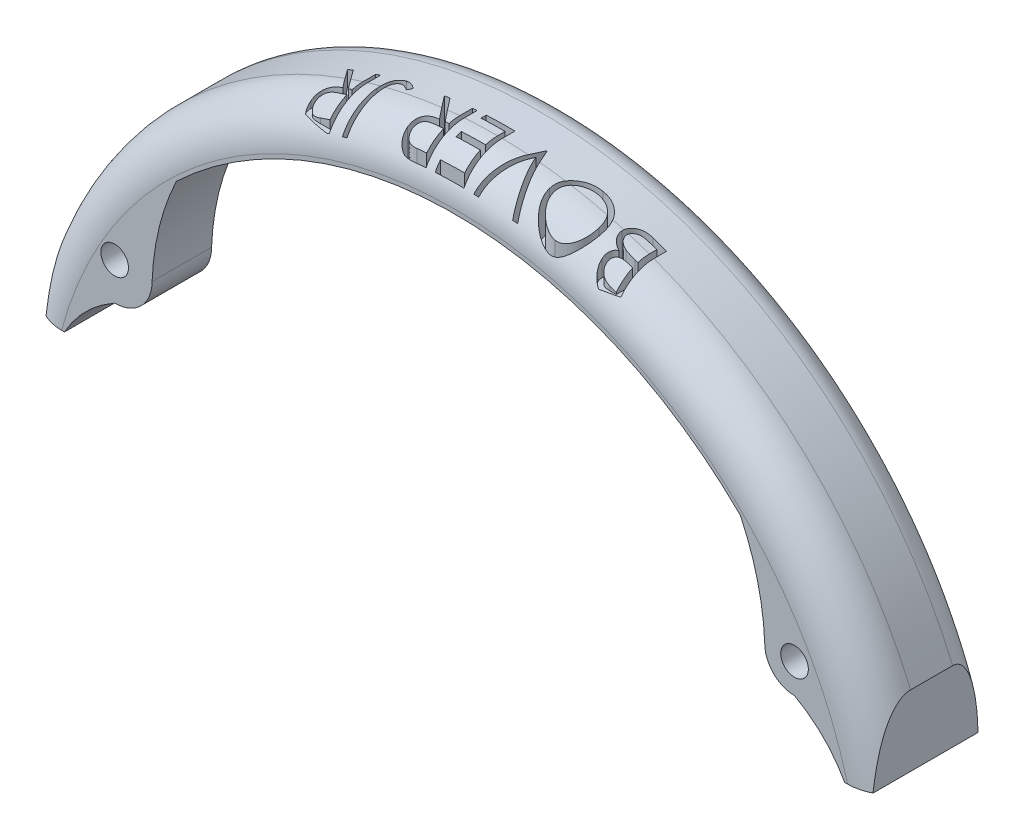
from build123d import *

# Parameters (mm, degrees)
CROQUIS1_R              = 1.625
SALIENTE_EXTRUIR1_DEPTH = 7
CORTAR_EXTRUIR4_START   = -7
CORTAR_EXTRUIR4_DEPTH   = 7
REDONDEO28_R            = 5
SALIENTE_EXTRUIR7_START = 5.95
SALIENTE_EXTRUIR7_DEPTH = 5.95
REDONDEO29_R            = 3
SALIENTE_EXTRUIR9_START = -12.95
CROQUIS18_W             = 3.387599535
CROQUIS18_H             = 3.438504458
SALIENTE_EXTRUIR9_DEPTH = 12.95
CORTAR_EXTRUIR12_DEPTH  = 8.75
CORTAR_EXTRUIR13_START  = -12.95
CROQUIS20_W             = 3.387599535
CROQUIS20_H             = 3.438504458
CORTAR_EXTRUIR13_DEPTH  = 12.95


with BuildPart() as part:
    # Croquis1 → Saliente-Extruir1 (new body)
    with BuildSketch(Plane.XY):
        with BuildLine():
            Line((201.408456983, -67.29), (195.908456983, -67.29))
            ThreePointArc((195.908456983, -67.29), (193.371958741, -63.925960745), (190, -61.4))
            ThreePointArc((190, -61.4), (187.525126266, -60.374873734), (186.5, -57.9))
            ThreePointArc((186.5, -57.9), (185.662126041, -51.918358313), (183.64304007, -46.225787551))
            ThreePointArc((183.64304007, -46.225787551), (150.62771573, -32.309143921), (117.25695993, -45.350511509))
            ThreePointArc((117.25695993, -45.350511509), (115.240326599, -51.031015035), (114.4, -57))
            ThreePointArc((114.4, -57), (113.111269837, -60.111269837), (110, -61.4))
            ThreePointArc((110, -61.4), (106.628041259, -63.925960745), (104.091543017, -67.29))
            Line((104.091543017, -67.29), (98.591543017, -67.29))
            ThreePointArc((98.591543017, -67.29), (150, -26.805006), (201.408456983, -67.29))
        make_face()
        with Locations((110, -57)):
            Circle(CROQUIS1_R, mode=Mode.SUBTRACT)
        with Locations((190, -57.9)):
            Circle(CROQUIS1_R, mode=Mode.SUBTRACT)
    extrude(amount=SALIENTE_EXTRUIR1_DEPTH)

    # Croquis7 → Cortar-Extruir4 (cut)
    with BuildSketch(Plane.XY.offset(7).offset(CORTAR_EXTRUIR4_START)):
        with BuildLine():
            Line((98.591543017, -67.29), (101.341543017, -67.29))
            Line((101.341543017, -67.29), (101.341543017, -58.977880832))
            ThreePointArc((101.341543017, -58.977880832), (99.794226936, -63.076930981), (98.591543017, -67.29))
        make_face()
        with BuildLine():
            Line((198.658456983, -58.977880832), (198.658456983, -67.29))
            Line((198.658456983, -67.29), (201.408456983, -67.29))
            ThreePointArc((201.408456983, -67.29), (200.205773064, -63.076930981), (198.658456983, -58.977880832))
        make_face()
    extrude(amount=CORTAR_EXTRUIR4_DEPTH, mode=Mode.SUBTRACT)

    # Redondeo28
    redondeo28_edges = [part.edges().sort_by_distance(p)[0] for p in [
        (150, -26.805006, 7),
    ]]
    fillet(redondeo28_edges, radius=REDONDEO28_R)

    # Croquis15 → Saliente-Extruir7 (add)
    with BuildSketch(Plane(origin=(0, 0, 0), x_dir=(-1, 0, 0), z_dir=(0, 0, -1)).offset(SALIENTE_EXTRUIR7_START)):
        with BuildLine():
            Line((-198.658456983, -67.29), (-198.408456983, -67.29))
            ThreePointArc((-198.408456983, -67.29), (-150, -29.805006), (-101.591543017, -67.29))
            Line((-101.591543017, -67.29), (-101.341543017, -67.29))
            Line((-101.341543017, -67.29), (-101.341543017, -58.977880832))
            ThreePointArc((-101.341543017, -58.977880832), (-150, -26.805006), (-198.658456983, -58.977880832))
            Line((-198.658456983, -58.977880832), (-198.658456983, -67.29))
        make_face()
    extrude(amount=-SALIENTE_EXTRUIR7_DEPTH)

    # Redondeo29
    redondeo29_edges = [part.edges().sort_by_distance(p)[0] for p in [
        (150, -26.805006, -5.95),
    ]]
    fillet(redondeo29_edges, radius=REDONDEO29_R - 0.0001)  # a hair under: the kernel refuses the full size


with BuildPart() as body_2:
    # Croquis18 → Saliente-Extruir9 (new body)
    with BuildSketch(Plane.XY.offset(7).offset(SALIENTE_EXTRUIR9_START)):
        with Locations((148.306200233, -25.085753771)):
            Rectangle(CROQUIS18_W, CROQUIS18_H)
    extrude(amount=SALIENTE_EXTRUIR9_DEPTH)


with BuildPart() as cortar_extruir12_tool:
    # Croquis19 → Cortar-Extruir12 (new body)
    # profile 1 of 7: a face of its own
    with BuildSketch(Plane(origin=(0, -23.366501542, 0), x_dir=(1, 0, 0), z_dir=(0, 1, 0))):
        with BuildLine():
            Line((168.451541471, -6.5), (167.280868394, -6.5))
            add(Edge.make_bspline(
                [(167.280868394, -6.5), (167.223561527, -6.499703457), (167.112486558, -6.499128682), (166.950979797, -6.490007425), (166.799653574, -6.477881577), (166.658775302, -6.45754112), (166.527428306, -6.436450748), (166.406946034, -6.405495132), (166.296319298, -6.371303525), (166.163479231, -6.318695099), (166.012753973, -6.236993549), (165.850752524, -6.115822388), (165.709930979, -5.97054795), (165.590190924, -5.804996269), (165.494096983, -5.622870659), (165.425456752, -5.428089612), (165.381359654, -5.223930087), (165.376881554, -5.083959855), (165.374618394, -5.013221154)],
                knots=[0, 0, 0, 0, 1.00128172, 1.940733171, 2.826250472, 3.653024905, 4.427672124, 5.149348099, 5.824709082, 6.450061444, 7.643590664, 8.808605388, 9.972104426, 11.165284501, 12.367876273, 13.557044126, 14.765369432, 16, 16, 16, 16], degree=3))
            add(Edge.make_bspline(
                [(165.374618394, -5.013221154), (165.376466975, -4.946951168), (165.38009961, -4.816724396), (165.415587522, -4.626891205), (165.469155665, -4.445617524), (165.546457747, -4.274650282), (165.645024399, -4.115491762), (165.764945542, -3.970856804), (165.907139149, -3.843585065), (166.013898896, -3.772756532), (166.068128009, -3.736778846)],
                knots=[0, 0, 0, 0, 1.044356178, 2.052258378, 3.035953355, 4.020338374, 5.002448483, 5.980768927, 6.974322109, 8, 8, 8, 8], degree=3))
            add(Edge.make_bspline(
                [(166.068128009, -3.736778846), (165.999962439, -3.71062201), (165.869544817, -3.660577502), (165.689841078, -3.571756712), (165.534961878, -3.475891001), (165.402911249, -3.372277699), (165.292262152, -3.25753354), (165.193691494, -3.134680388), (165.110037606, -2.999439684), (165.038662176, -2.85474203), (164.982121493, -2.701353691), (164.942874398, -2.540422195), (164.917983765, -2.373770312), (164.914728861, -2.260505003), (164.913079932, -2.203125)],
                knots=[0, 0, 0, 0, 1.272200328, 2.434034374, 3.488177493, 4.442517805, 5.351202203, 6.260825393, 7.183200622, 8.11705787, 9.069326169, 10.026320267, 11.000137371, 12, 12, 12, 12], degree=3))
            add(Edge.make_bspline(
                [(164.913079932, -2.203125), (164.914754686, -2.144553317), (164.918049811, -2.029311889), (164.942356039, -1.860015981), (164.983522945, -1.698235472), (165.040185296, -1.542893485), (165.114047523, -1.39489981), (165.203280769, -1.253091381), (165.310379484, -1.119569822), (165.430983171, -0.992397568), (165.565542188, -0.876104037), (165.713815697, -0.7761652), (165.872003602, -0.689843918), (166.042272098, -0.620446449), (166.223413014, -0.566120924), (166.415468783, -0.528560346), (166.618330351, -0.503150379), (166.757549088, -0.501067945), (166.828945317, -0.5)],
                knots=[0, 0, 0, 0, 0.978522333, 1.925270105, 2.85076145, 3.763600118, 4.682725947, 5.609499657, 6.557784645, 7.537954401, 8.534920712, 9.522742111, 10.520247711, 11.5409147, 12.58930695, 13.675078472, 14.807699069, 16, 16, 16, 16], degree=3))
            Line((166.828945317, -0.5), (168.451541471, -0.5))
            Line((168.451541471, -0.5), (168.451541471, -6.5))
        make_face()
        with BuildLine():
            Line((167.913079932, -5.884615385), (167.913079932, -3.961538462))
            Line((167.913079932, -3.961538462), (167.551301086, -3.961538462))
            add(Edge.make_bspline(
                [(167.551301086, -3.961538462), (167.498416961, -3.962218339), (167.396234053, -3.963532), (167.247863841, -3.967413621), (167.110485575, -3.977806367), (166.983625904, -3.98879843), (166.868134998, -4.005723885), (166.763626546, -4.026436107), (166.669160697, -4.048148992), (166.560273583, -4.085181811), (166.436776924, -4.139339532), (166.306047749, -4.225446041), (166.188385615, -4.325138763), (166.091321145, -4.44338991), (166.010511452, -4.571090454), (165.956105423, -4.709192663), (165.918171516, -4.852937497), (165.914794513, -4.952071369), (165.913079932, -5.002403846)],
                knots=[0, 0, 0, 0, 1.156584208, 2.234756387, 3.244705828, 4.168772894, 5.018724976, 5.795346628, 6.498686023, 7.135894168, 8.308330183, 9.43588092, 10.547699294, 11.667188675, 12.76860303, 13.837480448, 14.902040606, 16, 16, 16, 16], degree=3))
            add(Edge.make_bspline(
                [(165.913079932, -5.002403846), (165.913916161, -5.035725045), (165.915556514, -5.101088215), (165.931020773, -5.1963186), (165.952361266, -5.28694029), (165.987557055, -5.370510288), (166.029254968, -5.449963077), (166.082701732, -5.522788895), (166.144330768, -5.590960602), (166.216182501, -5.652650918), (166.297963214, -5.708446249), (166.392263527, -5.754893197), (166.496519645, -5.796170034), (166.612905634, -5.827458844), (166.739103191, -5.854622511), (166.877037641, -5.871751769), (167.025877699, -5.882755875), (167.1290033, -5.883981723), (167.182310702, -5.884615385)],
                knots=[0, 0, 0, 0, 0.911412742, 1.787835618, 2.63643285, 3.453173233, 4.262886967, 5.08783453, 5.918594724, 6.773969545, 7.67442701, 8.62112486, 9.645634318, 10.739428598, 11.916091468, 13.177237585, 14.540865421, 16, 16, 16, 16], degree=3))
            Line((167.182310702, -5.884615385), (167.913079932, -5.884615385))
        make_face(mode=Mode.SUBTRACT)
        with BuildLine():
            Line((167.913079932, -3.346153846), (167.913079932, -1.115384615))
            Line((167.913079932, -1.115384615), (167.146253009, -1.115384615))
            add(Edge.make_bspline(
                [(167.146253009, -1.115384615), (167.091368909, -1.116105725), (166.985587042, -1.11749557), (166.832740006, -1.12079348), (166.691826737, -1.133028713), (166.561673985, -1.144759099), (166.442883954, -1.163923122), (166.334301207, -1.182480509), (166.238405826, -1.20978862), (166.126202692, -1.247365064), (166.000704614, -1.307417203), (165.863654792, -1.395729017), (165.742942406, -1.503299315), (165.640526406, -1.627160406), (165.555371992, -1.760445305), (165.496461954, -1.903416341), (165.458291604, -2.051298048), (165.453796045, -2.152414135), (165.451541471, -2.203125)],
                knots=[0, 0, 0, 0, 1.16016216, 2.236059617, 3.229676189, 4.14889023, 4.996733752, 5.772278665, 6.474820656, 7.101410824, 8.271817372, 9.403828207, 10.537358096, 11.673541442, 12.791884111, 13.865947414, 14.929748409, 16, 16, 16, 16], degree=3))
            add(Edge.make_bspline(
                [(165.451541471, -2.203125), (165.452001698, -2.234832625), (165.45291473, -2.297736427), (165.467266682, -2.390094221), (165.487183519, -2.48000191), (165.516535344, -2.566238249), (165.552043071, -2.650288214), (165.598886809, -2.729416974), (165.651726198, -2.806992913), (165.733566422, -2.906221129), (165.85422699, -3.019168728), (166.025750247, -3.128369659), (166.219687713, -3.217863225), (166.360679771, -3.255696627), (166.433512625, -3.275240385)],
                knots=[0, 0, 0, 0, 0.723354195, 1.435040621, 2.129761981, 2.824182007, 3.512608497, 4.209435533, 4.920062464, 5.654614313, 7.143585817, 8.671381114, 10.280521501, 12, 12, 12, 12], degree=3))
            add(Edge.make_bspline(
                [(166.433512625, -3.275240385), (166.462705333, -3.281163784), (166.526001147, -3.294006935), (166.629214666, -3.307555342), (166.7474427, -3.319708704), (166.880179921, -3.32846252), (167.027954243, -3.337859589), (167.190718192, -3.341384063), (167.368586834, -3.345685869), (167.49200248, -3.345993863), (167.556108778, -3.346153846)],
                knots=[0, 0, 0, 0, 0.634452549, 1.375623993, 2.216454381, 3.166361212, 4.209414599, 5.370755378, 6.634280627, 8, 8, 8, 8], degree=3))
            Line((167.556108778, -3.346153846), (167.913079932, -3.346153846))
        make_face(mode=Mode.SUBTRACT)
    # profile 2 of 7: a face of its own
    with BuildSketch(Plane(origin=(0, -23.366501542, 0), x_dir=(1, 0, 0), z_dir=(0, 1, 0))):
        with BuildLine():
            add(Edge.make_bspline(
                [(160.874618394, -6.653846154), (160.763506693, -6.651079535), (160.545274144, -6.645645668), (160.224836933, -6.602677828), (159.918005397, -6.53195532), (159.624596275, -6.432086813), (159.345750703, -6.302595472), (159.080587091, -6.145390078), (158.83001688, -5.958925611), (158.594688152, -5.747628415), (158.380797093, -5.51536865), (158.194677211, -5.26602143), (158.036271834, -5.004605418), (157.906848977, -4.729418181), (157.805152972, -4.441688345), (157.735017287, -4.139701845), (157.690205956, -3.825464048), (157.684967904, -3.611131971), (157.682310702, -3.502403846)],
                knots=[0, 0, 0, 0, 1.065027606, 2.091802087, 3.093458616, 4.079833113, 5.057734272, 6.036020118, 7.030157768, 8.047461502, 9.064242947, 10.052216774, 11.02588392, 11.989864716, 12.962978571, 13.945936472, 14.957997893, 16, 16, 16, 16], degree=3))
            add(Edge.make_bspline(
                [(157.682310702, -3.502403846), (157.684968793, -3.394477262), (157.690208201, -3.18174146), (157.735053697, -2.869488869), (157.805465741, -2.569357939), (157.905590903, -2.282046735), (158.035109092, -2.007414187), (158.193763722, -1.74581527), (158.379465448, -1.495740983), (158.592479545, -1.262350593), (158.825092679, -1.048439804), (159.072899365, -0.859339451), (159.335600576, -0.701808014), (159.609096187, -0.570450398), (159.896108089, -0.470964552), (160.194612061, -0.39846741), (160.506300643, -0.354107689), (160.718623167, -0.34883422), (160.826541471, -0.346153846)],
                knots=[0, 0, 0, 0, 1.043683505, 2.0572211, 3.045299494, 4.022276905, 4.994977706, 5.977452478, 6.97747046, 8.003698437, 9.029677512, 10.031249186, 11.013723958, 11.988083691, 12.9614021, 13.946617861, 14.956316495, 16, 16, 16, 16], degree=3))
            add(Edge.make_bspline(
                [(160.826541471, -0.346153846), (160.935269087, -0.348809581), (161.149600162, -0.354044743), (161.464232032, -0.398932262), (161.766433629, -0.469098611), (162.055274479, -0.569469066), (162.330849368, -0.698697758), (162.593131644, -0.857500628), (162.84243648, -1.044628001), (163.076226911, -1.257474817), (163.28987976, -1.489641901), (163.477799778, -1.737123213), (163.635687116, -1.997565062), (163.764970361, -2.269893858), (163.867228485, -2.553405678), (163.937014635, -2.849883918), (163.982160229, -3.157667248), (163.987363064, -3.367226321), (163.990003009, -3.473557692)],
                knots=[0, 0, 0, 0, 1.053167129, 2.076072758, 3.073341244, 4.055601477, 5.033424535, 6.017524495, 7.021518915, 8.049444456, 9.077120685, 10.074910483, 11.055688766, 12.022980584, 12.991883888, 13.970269434, 14.970104079, 16, 16, 16, 16], degree=3))
            add(Edge.make_bspline(
                [(163.990003009, -3.473557692), (163.989087332, -3.544928308), (163.987267528, -3.686769168), (163.965326547, -3.897392826), (163.933552832, -4.104651942), (163.887777923, -4.307849809), (163.828732174, -4.507019611), (163.755968305, -4.701754033), (163.672580882, -4.893657115), (163.573296638, -5.079076602), (163.464974555, -5.258303522), (163.346860208, -5.429096791), (163.218130048, -5.588405581), (163.080622955, -5.738789728), (162.932435522, -5.877682518), (162.775797966, -6.008112132), (162.609890688, -6.128728412), (162.434451302, -6.236998083), (162.253952702, -6.336445091), (162.06708536, -6.41947516), (161.877791991, -6.492862605), (161.684405224, -6.551183862), (161.487372394, -6.597596265), (161.286447189, -6.629132321), (161.08183656, -6.651122054), (160.9439883, -6.652934214), (160.874618394, -6.653846154)],
                knots=[0, 0, 0, 0, 1.037115869, 2.061148057, 3.07517727, 4.084041727, 5.086514338, 6.092668487, 7.104487461, 8.125783165, 9.147610153, 10.147694368, 11.141876323, 12.122903372, 13.107606018, 14.091946891, 15.084523921, 16.086505767, 17.087268121, 18.077809654, 19.05670789, 20.036870126, 21.011670792, 21.99694167, 22.991993299, 24, 24, 24, 24], degree=3))
        make_face()
        with BuildLine():
            add(Edge.make_bspline(
                [(160.848176086, -6.038461538), (160.905116317, -6.037770194), (161.018452425, -6.036394114), (161.186927506, -6.01815504), (161.353247196, -5.992371352), (161.517046095, -5.954828548), (161.678470688, -5.906724348), (161.837700151, -5.847322547), (161.994876676, -5.777974967), (162.148562966, -5.697478012), (162.29630459, -5.607249283), (162.438989271, -5.512118243), (162.571167706, -5.406692996), (162.695392966, -5.294883091), (162.811363666, -5.175149062), (162.919095299, -5.048372939), (163.018481727, -4.913980777), (163.108331649, -4.772532525), (163.188290816, -4.624816075), (163.259881678, -4.473655625), (163.319227753, -4.317274592), (163.366238692, -4.156648876), (163.406140205, -3.992486311), (163.431169388, -3.82389248), (163.449583212, -3.651448587), (163.450883692, -3.534907602), (163.451541471, -3.475961538)],
                knots=[0, 0, 0, 0, 1.008431664, 2.007222653, 2.999229743, 3.989431819, 4.982149843, 5.98167215, 6.998687425, 8.024288174, 9.053028776, 10.065052016, 11.06063401, 12.045759335, 13.024701188, 14.011819507, 14.991481775, 15.984022113, 16.97831254, 17.965966747, 18.945551853, 19.938269878, 20.93007375, 21.936103907, 22.956087853, 24, 24, 24, 24], degree=3))
            add(Edge.make_bspline(
                [(163.451541471, -3.475961538), (163.449350993, -3.389285416), (163.445041645, -3.21876667), (163.407471439, -2.968850306), (163.349139982, -2.728436265), (163.264570387, -2.498957506), (163.156685182, -2.279390722), (163.025087134, -2.070590388), (162.868571083, -1.872618097), (162.690887164, -1.686947554), (162.496594481, -1.51754616), (162.290383131, -1.368641445), (162.07388458, -1.243319084), (161.84834667, -1.138552406), (161.611843798, -1.05962555), (161.365892328, -1.003350738), (161.110486824, -0.966877433), (160.936442776, -0.963335008), (160.848176086, -0.961538462)],
                knots=[0, 0, 0, 0, 1.032022337, 2.030307203, 3.003823408, 3.974715386, 4.937372378, 5.913284036, 6.909147208, 7.938749767, 8.970518239, 9.975863271, 10.963918693, 11.946286286, 12.933361397, 13.927862637, 14.949112547, 16, 16, 16, 16], degree=3))
            add(Edge.make_bspline(
                [(160.848176086, -0.961538462), (160.788845277, -0.962352952), (160.671174462, -0.963968331), (160.496157013, -0.980261449), (160.324276288, -1.006336925), (160.155850418, -1.044066364), (159.990656679, -1.090659433), (159.829201134, -1.148462322), (159.671508868, -1.217720692), (159.516912011, -1.295030698), (159.36875912, -1.382221885), (159.228732636, -1.47802363), (159.095911722, -1.579870768), (158.971913205, -1.690870952), (158.856426661, -1.809594966), (158.750620437, -1.936907461), (158.651280348, -2.070292859), (158.56206062, -2.211705158), (158.481004569, -2.358252778), (158.41151679, -2.509853275), (158.352136611, -2.665546465), (158.304278718, -2.825485994), (158.266755505, -2.989301588), (158.240905647, -3.157230537), (158.222822222, -3.328932047), (158.221459285, -3.445064402), (158.22077224, -3.503605769)],
                knots=[0, 0, 0, 0, 1.047362266, 2.077233941, 3.100744636, 4.115120168, 5.122788643, 6.129711893, 7.140355774, 8.162227187, 9.180148637, 10.17298275, 11.156396779, 12.133377858, 13.108923632, 14.078087502, 15.054351192, 16.043448276, 17.028082865, 18.009331763, 18.985518559, 19.968016174, 20.954783108, 21.950335389, 22.966780876, 24, 24, 24, 24], degree=3))
            add(Edge.make_bspline(
                [(158.22077224, -3.503605769), (158.221459862, -3.561746634), (158.222823888, -3.677079748), (158.240896701, -3.847584008), (158.266783942, -4.0143038), (158.304091442, -4.176584604), (158.352177418, -4.334467792), (158.411469991, -4.487805065), (158.481387623, -4.637167721), (158.561630385, -4.78218638), (158.651828596, -4.921343578), (158.75039143, -5.054374416), (158.859012987, -5.178791806), (158.974618239, -5.297625188), (159.099986559, -5.408497746), (159.235139932, -5.510980716), (159.376712819, -5.609693063), (159.527908302, -5.697050405), (159.683383216, -5.778144517), (159.843081377, -5.847272672), (160.005005765, -5.906988203), (160.169372654, -5.954621374), (160.335898109, -5.992407822), (160.504628402, -6.018145696), (160.675500879, -6.036396074), (160.790435032, -6.037770865), (160.848176086, -6.038461538)],
                knots=[0, 0, 0, 0, 1.02988216, 2.042960975, 3.035124439, 4.018561492, 4.99104521, 5.957523397, 6.929462691, 7.91146347, 8.892205782, 9.866320947, 10.842813644, 11.816825305, 12.802668543, 13.805243666, 14.821427616, 15.858893029, 16.897256944, 17.927432741, 18.940436917, 19.95373962, 20.957947499, 21.96413624, 22.977215056, 24, 24, 24, 24], degree=3))
        make_face(mode=Mode.SUBTRACT)
    # profile 3 of 7: a face of its own
    with BuildSketch(Plane(origin=(0, -23.366501542, 0), x_dir=(1, 0, 0), z_dir=(0, 1, 0))):
        Polygon((156.913079932, -6.5), (156.336156855, -6.5), (154.336156855, -1.771634615), (152.336156855, -6.5), (151.759233778, -6.5), (154.297695317, -0.5), (154.374618394, -0.5), align=None)
    # profile 4 of 7: a face of its own
    with BuildSketch(Plane(origin=(0, -23.366501542, 0), x_dir=(1, 0, 0), z_dir=(0, 1, 0))):
        Polygon((150.605387625, -6.5), (147.22077224, -6.5), (147.22077224, -5.884615385), (150.066926086, -5.884615385), (150.066926086, -4.038461538), (147.22077224, -4.038461538), (147.22077224, -3.423076923), (150.066926086, -3.423076923), (150.066926086, -1.115384615), (147.22077224, -1.115384615), (147.22077224, -0.5), (150.605387625, -0.5), align=None)
    # profile 5 of 7: a face of its own
    with BuildSketch(Plane(origin=(0, -23.366501542, 0), x_dir=(1, 0, 0), z_dir=(0, 1, 0))):
        with BuildLine():
            Line((146.143849163, -6.5), (144.943128009, -6.5))
            add(Edge.make_bspline(
                [(144.943128009, -6.5), (144.86300036, -6.499733281), (144.709146398, -6.499221151), (144.488735078, -6.496365558), (144.288460054, -6.488180948), (144.108426044, -6.481137662), (143.94863635, -6.468294334), (143.808600994, -6.456018939), (143.688964941, -6.439949806), (143.616543482, -6.425026224), (143.583753009, -6.418269231)],
                knots=[0, 0, 0, 0, 1.410062039, 2.707475311, 3.878576406, 4.937260626, 5.877586885, 6.699081471, 7.410979367, 8, 8, 8, 8], degree=3))
            add(Edge.make_bspline(
                [(143.583753009, -6.418269231), (143.5398552, -6.407424548), (143.452996041, -6.38596653), (143.327949508, -6.340589791), (143.208742536, -6.288163286), (143.095811663, -6.226116089), (142.989186481, -6.155495946), (142.888877735, -6.076018961), (142.796230366, -5.987004178), (142.707948123, -5.89213894), (142.630860863, -5.787292932), (142.561461878, -5.67778681), (142.503203809, -5.561512309), (142.457361209, -5.43905589), (142.418930016, -5.31161879), (142.393100666, -5.177941756), (142.377013695, -5.038459706), (142.375424301, -4.943554644), (142.374618394, -4.895432692)],
                knots=[0, 0, 0, 0, 1.027276577, 2.032638556, 3.019345632, 3.985365262, 4.957888996, 5.923693931, 6.890056973, 7.876427719, 8.865527834, 9.843495157, 10.821038291, 11.815616373, 12.812734995, 13.843357168, 14.906466538, 16, 16, 16, 16], degree=3))
            add(Edge.make_bspline(
                [(142.374618394, -4.895432692), (142.377136611, -4.815486707), (142.382050305, -4.659491382), (142.427865681, -4.433102585), (142.502907805, -4.221916204), (142.606331457, -4.026226137), (142.737976469, -3.849743816), (142.896183838, -3.695257921), (143.080145611, -3.564787545), (143.25220599, -3.475273367), (143.40426722, -3.417676108), (143.52982094, -3.376947024), (143.666882821, -3.34600935), (143.813486502, -3.317891327), (143.970764366, -3.296435016), (144.138399693, -3.281196957), (144.316811748, -3.27139877), (144.439108482, -3.269967213), (144.50202224, -3.269230769)],
                knots=[0, 0, 0, 0, 1.260402266, 2.459371274, 3.627181936, 4.786749125, 5.93865593, 7.087644312, 8.261344208, 9.485713728, 10.136162886, 10.825977872, 11.566646758, 12.35154167, 13.181268117, 14.0701832, 15.007234106, 16, 16, 16, 16], degree=3))
            Line((144.50202224, -3.269230769), (142.297695317, -0.5))
            Line((142.297695317, -0.5), (142.963560702, -0.5))
            Line((142.963560702, -0.5), (145.167887625, -3.269230769))
            Line((145.167887625, -3.269230769), (145.605387625, -3.269230769))
            Line((145.605387625, -3.269230769), (145.605387625, -0.5))
            Line((145.605387625, -0.5), (146.143849163, -0.5))
            Line((146.143849163, -0.5), (146.143849163, -6.5))
        make_face()
        with BuildLine():
            Line((145.605387625, -5.884615385), (145.605387625, -3.884615385))
            Line((145.605387625, -3.884615385), (144.506829932, -3.876201923))
            add(Edge.make_bspline(
                [(144.506829932, -3.876201923), (144.455538431, -3.876179219), (144.356120891, -3.876135211), (144.212291268, -3.882981861), (144.078370779, -3.890769806), (143.95487334, -3.902684973), (143.84173823, -3.918031658), (143.739040176, -3.937258236), (143.646552228, -3.959563264), (143.539027699, -3.994438896), (143.417578567, -4.047310553), (143.288312304, -4.129292652), (143.175272659, -4.228437918), (143.081292674, -4.343242816), (143.005807844, -4.47001115), (142.953376905, -4.605873964), (142.918825222, -4.748690607), (142.915017109, -4.846751377), (142.913079932, -4.896634615)],
                knots=[0, 0, 0, 0, 1.146399208, 2.222048177, 3.218135709, 4.144938032, 4.994811973, 5.769438708, 6.479732432, 7.119818093, 8.294689872, 9.430121864, 10.527913442, 11.641375077, 12.733452768, 13.811150417, 14.886538365, 16, 16, 16, 16], degree=3))
            add(Edge.make_bspline(
                [(142.913079932, -4.896634615), (142.915115195, -4.944895321), (142.919148344, -5.040530429), (142.952826768, -5.180222658), (143.0078183, -5.313051633), (143.083087594, -5.437189542), (143.176768303, -5.54903955), (143.285885229, -5.644447767), (143.407870611, -5.723710195), (143.520958996, -5.776007737), (143.62277837, -5.806779692), (143.710775298, -5.829117021), (143.811071194, -5.844761074), (143.922485587, -5.859149423), (144.045507913, -5.87133415), (144.180213141, -5.879421772), (144.326504957, -5.884255757), (144.427899668, -5.884492719), (144.480387625, -5.884615385)],
                knots=[0, 0, 0, 0, 1.100596872, 2.180981401, 3.259506136, 4.371595435, 5.481727359, 6.576991111, 7.667816242, 8.793363246, 9.406619729, 10.09427138, 10.864108636, 11.721733836, 12.6590937, 13.685439239, 14.801845161, 16, 16, 16, 16], degree=3))
            Line((144.480387625, -5.884615385), (145.605387625, -5.884615385))
        make_face(mode=Mode.SUBTRACT)
    # profile 6 of 7: a face of its own
    with BuildSketch(Plane(origin=(0, -23.366501542, 0), x_dir=(1, 0, 0), z_dir=(0, 1, 0))):
        with BuildLine():
            Line((136.836156855, -6.5), (136.297695317, -6.5))
            Line((136.297695317, -6.5), (136.297695317, -2.448317308))
            add(Edge.make_bspline(
                [(136.297695317, -2.448317308), (136.298231021, -2.373393781), (136.299259638, -2.229531468), (136.304973645, -2.022324031), (136.315402906, -1.832702163), (136.331081299, -1.661174823), (136.349760062, -1.507476993), (136.373474686, -1.371383134), (136.401679411, -1.2528363), (136.444385743, -1.1197899), (136.514002256, -0.973357651), (136.620861724, -0.816630777), (136.750799637, -0.67803336), (136.903485391, -0.560107625), (137.075639345, -0.462761629), (137.267974011, -0.394735735), (137.476968497, -0.352807429), (137.622008616, -0.348416215), (137.696733778, -0.346153846)],
                knots=[0, 0, 0, 0, 1.23761369, 2.376369303, 3.423688776, 4.373947637, 5.221061685, 5.980504468, 6.65465141, 7.232267317, 8.286152468, 9.319580031, 10.354278202, 11.410653829, 12.495036873, 13.606623453, 14.766924254, 16, 16, 16, 16], degree=3))
            add(Edge.make_bspline(
                [(137.696733778, -0.346153846), (137.755349328, -0.347979462), (137.872487138, -0.351627789), (138.047328123, -0.38212328), (138.22058453, -0.430028774), (138.394836596, -0.498889679), (138.572270212, -0.592132841), (138.757441568, -0.712599778), (138.950042784, -0.863485229), (139.07725781, -0.978340147), (139.143849163, -1.038461538)],
                knots=[0, 0, 0, 0, 0.854547984, 1.707735923, 2.581180402, 3.47327429, 4.435225703, 5.500268456, 6.691502816, 8, 8, 8, 8], degree=3))
            Line((139.143849163, -1.038461538), (138.826541471, -1.5))
            add(Edge.make_bspline(
                [(138.826541471, -1.5), (138.753183666, -1.449772763), (138.614782028, -1.355010768), (138.413522432, -1.229211943), (138.231833408, -1.127012906), (138.114141055, -1.073037638), (138.059714548, -1.048076923)],
                knots=[0, 0, 0, 0, 1.196638425, 2.257656398, 3.194257951, 4, 4, 4, 4], degree=3))
            add(Edge.make_bspline(
                [(138.059714548, -1.048076923), (138.026737732, -1.034434165), (137.96228738, -1.007770566), (137.862316028, -0.982279581), (137.764327961, -0.963821351), (137.698820359, -0.962289774), (137.666685702, -0.961538462)],
                knots=[0, 0, 0, 0, 1.055403208, 2.062694816, 3.049657822, 4, 4, 4, 4], degree=3))
            add(Edge.make_bspline(
                [(137.666685702, -0.961538462), (137.625227462, -0.963267812), (137.543669475, -0.966669847), (137.424469464, -0.997528061), (137.310836358, -1.045213519), (137.205494544, -1.113536705), (137.109577599, -1.194958395), (137.028981244, -1.292108779), (136.963506037, -1.40139713), (136.921759185, -1.503965846), (136.896640267, -1.598308697), (136.879991681, -1.684622974), (136.867946288, -1.78593597), (136.854966879, -1.901605001), (136.847975528, -2.032425327), (136.839821009, -2.177794366), (136.83691827, -2.33813081), (136.836418405, -2.449920589), (136.836156855, -2.508413462)],
                knots=[0, 0, 0, 0, 0.997338315, 1.961996122, 2.948199042, 3.955162468, 4.975046525, 5.968827587, 6.982064989, 8.034375777, 8.624523585, 9.332616724, 10.150461195, 11.082242492, 12.136676661, 13.306224245, 14.590509051, 16, 16, 16, 16], degree=3))
            Line((136.836156855, -2.508413462), (136.836156855, -6.5))
        make_face()
    # profile 7 of 7: a face of its own
    with BuildSketch(Plane(origin=(0, -23.366501542, 0), x_dir=(1, 0, 0), z_dir=(0, 1, 0))):
        with BuildLine():
            Line((134.759233778, -6.5), (133.558512625, -6.5))
            add(Edge.make_bspline(
                [(133.558512625, -6.5), (133.478384976, -6.499733281), (133.324531014, -6.499221151), (133.104119693, -6.496365558), (132.90384467, -6.488180948), (132.72381066, -6.481137662), (132.564020965, -6.468294334), (132.42398561, -6.456018939), (132.304349557, -6.439949806), (132.231928098, -6.425026224), (132.199137625, -6.418269231)],
                knots=[0, 0, 0, 0, 1.410062039, 2.707475311, 3.878576406, 4.937260626, 5.877586885, 6.699081471, 7.410979367, 8, 8, 8, 8], degree=3))
            add(Edge.make_bspline(
                [(132.199137625, -6.418269231), (132.155239816, -6.407424548), (132.068380657, -6.38596653), (131.943334124, -6.340589791), (131.824127151, -6.288163286), (131.711196278, -6.226116089), (131.604571097, -6.155495946), (131.50426235, -6.076018961), (131.411614981, -5.987004178), (131.323332739, -5.89213894), (131.246245478, -5.787292932), (131.176846494, -5.67778681), (131.118588424, -5.561512309), (131.072745825, -5.43905589), (131.034314631, -5.31161879), (131.008485281, -5.177941756), (130.99239831, -5.038459706), (130.990808917, -4.943554644), (130.990003009, -4.895432692)],
                knots=[0, 0, 0, 0, 1.027276577, 2.032638556, 3.019345632, 3.985365262, 4.957888996, 5.923693931, 6.890056973, 7.876427719, 8.865527834, 9.843495157, 10.821038291, 11.815616373, 12.812734995, 13.843357168, 14.906466538, 16, 16, 16, 16], degree=3))
            add(Edge.make_bspline(
                [(130.990003009, -4.895432692), (130.992521226, -4.815486707), (130.99743492, -4.659491382), (131.043250296, -4.433102585), (131.118292421, -4.221916204), (131.221716072, -4.026226137), (131.353361084, -3.849743816), (131.511568454, -3.695257921), (131.695530226, -3.564787545), (131.867590605, -3.475273367), (132.019651835, -3.417676108), (132.145205555, -3.376947024), (132.282267436, -3.34600935), (132.428871118, -3.317891327), (132.586148981, -3.296435016), (132.753784308, -3.281196957), (132.932196363, -3.27139877), (133.054493098, -3.269967213), (133.117406855, -3.269230769)],
                knots=[0, 0, 0, 0, 1.260402266, 2.459371274, 3.627181936, 4.786749125, 5.93865593, 7.087644312, 8.261344208, 9.485713728, 10.136162886, 10.825977872, 11.566646758, 12.35154167, 13.181268117, 14.0701832, 15.007234106, 16, 16, 16, 16], degree=3))
            Line((133.117406855, -3.269230769), (130.913079932, -0.5))
            Line((130.913079932, -0.5), (131.578945317, -0.5))
            Line((131.578945317, -0.5), (133.78327224, -3.269230769))
            Line((133.78327224, -3.269230769), (134.22077224, -3.269230769))
            Line((134.22077224, -3.269230769), (134.22077224, -0.5))
            Line((134.22077224, -0.5), (134.759233778, -0.5))
            Line((134.759233778, -0.5), (134.759233778, -6.5))
        make_face()
        with BuildLine():
            Line((134.22077224, -5.884615385), (134.22077224, -3.884615385))
            Line((134.22077224, -3.884615385), (133.122214548, -3.876201923))
            add(Edge.make_bspline(
                [(133.122214548, -3.876201923), (133.070923046, -3.876179219), (132.971505507, -3.876135211), (132.827675883, -3.882981861), (132.693755394, -3.890769806), (132.570257956, -3.902684973), (132.457122846, -3.918031658), (132.354424791, -3.937258236), (132.261936843, -3.959563264), (132.154412315, -3.994438896), (132.032963183, -4.047310553), (131.903696919, -4.129292652), (131.790657274, -4.228437918), (131.696677289, -4.343242816), (131.621192459, -4.47001115), (131.56876152, -4.605873964), (131.534209837, -4.748690607), (131.530401724, -4.846751377), (131.528464548, -4.896634615)],
                knots=[0, 0, 0, 0, 1.146399208, 2.222048177, 3.218135709, 4.144938032, 4.994811973, 5.769438708, 6.479732432, 7.119818093, 8.294689872, 9.430121864, 10.527913442, 11.641375077, 12.733452768, 13.811150417, 14.886538365, 16, 16, 16, 16], degree=3))
            add(Edge.make_bspline(
                [(131.528464548, -4.896634615), (131.530499811, -4.944895321), (131.534532959, -5.040530429), (131.568211383, -5.180222658), (131.623202916, -5.313051633), (131.69847221, -5.437189542), (131.792152918, -5.54903955), (131.901269845, -5.644447767), (132.023255226, -5.723710195), (132.136343612, -5.776007737), (132.238162986, -5.806779692), (132.326159914, -5.829117021), (132.426455809, -5.844761074), (132.537870202, -5.859149423), (132.660892528, -5.87133415), (132.795597757, -5.879421772), (132.941889572, -5.884255757), (133.043284284, -5.884492719), (133.09577224, -5.884615385)],
                knots=[0, 0, 0, 0, 1.100596872, 2.180981401, 3.259506136, 4.371595435, 5.481727359, 6.576991111, 7.667816242, 8.793363246, 9.406619729, 10.09427138, 10.864108636, 11.721733836, 12.6590937, 13.685439239, 14.801845161, 16, 16, 16, 16], degree=3))
            Line((133.09577224, -5.884615385), (134.22077224, -5.884615385))
        make_face(mode=Mode.SUBTRACT)
    extrude(amount=-CORTAR_EXTRUIR12_DEPTH)


with BuildPart() as part_1:
    add(part.part)

    # Cortar-Extruir12: cut by cortar_extruir12_tool
    add(cortar_extruir12_tool.part, mode=Mode.SUBTRACT)


with BuildPart() as body_2_1:
    add(body_2.part)

    # Cortar-Extruir12: cut by cortar_extruir12_tool
    add(cortar_extruir12_tool.part, mode=Mode.SUBTRACT)

    # Croquis20 → Cortar-Extruir13 (cut)
    with BuildSketch(Plane.XY.offset(7).offset(CORTAR_EXTRUIR13_START)):
        with Locations((148.306200233, -25.085753771)):
            Rectangle(CROQUIS20_W, CROQUIS20_H)
    extrude(amount=CORTAR_EXTRUIR13_DEPTH, mode=Mode.SUBTRACT)


solid = part_1.part
